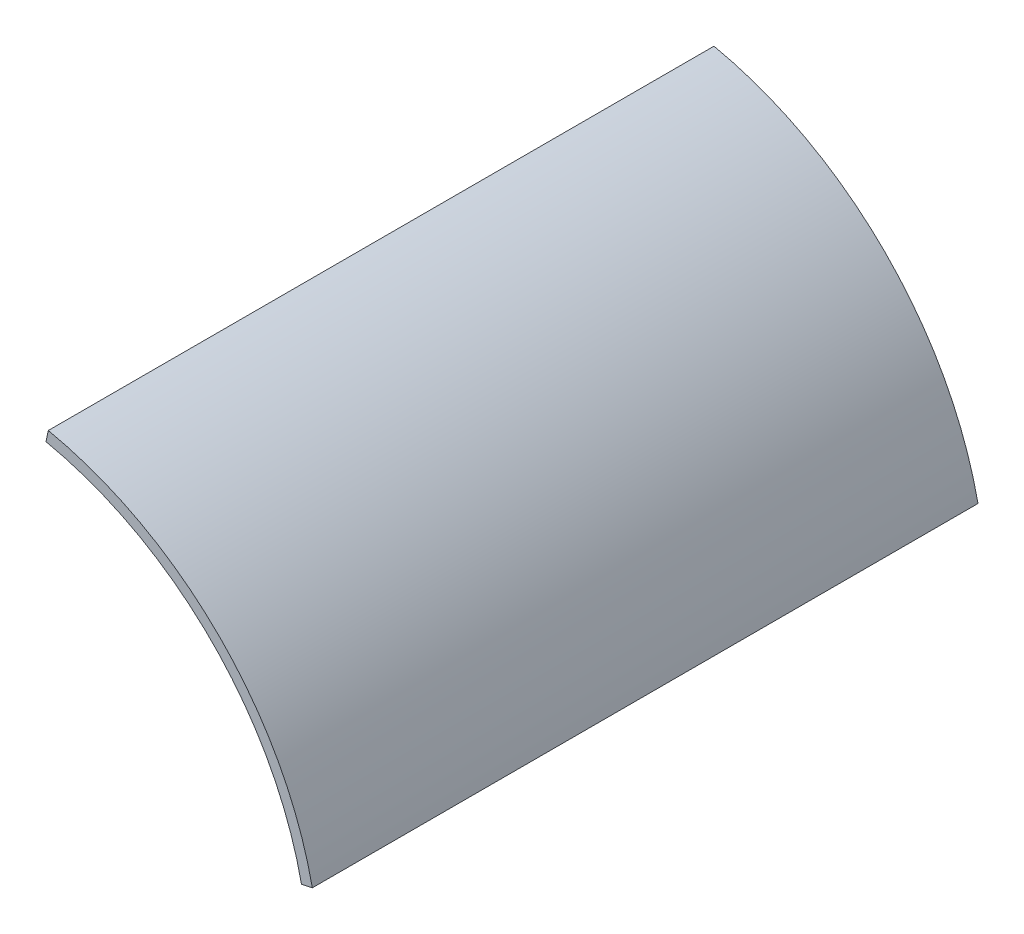
from build123d import *

# Parameters (mm, degrees)
SALIENTE_EXTRUIR1_DEPTH = 60


with BuildPart() as part:
    # Croquis1 → Saliente-Extruir1 (new body)
    with BuildSketch(Plane.XY):
        with BuildLine():
            Line((6.424471246, 30.224760863), (6.216559555, 29.246613262))
            ThreePointArc((6.216559555, 29.246613262), (21.142492757, 21.142492757), (29.246613262, 6.216559555))
            Line((29.246613262, 6.216559555), (30.224760863, 6.424471246))
            ThreePointArc((30.224760863, 6.424471246), (21.849599539, 21.849599539), (6.424471246, 30.224760863))
        make_face()
    extrude(amount=SALIENTE_EXTRUIR1_DEPTH)


solid = part.part
